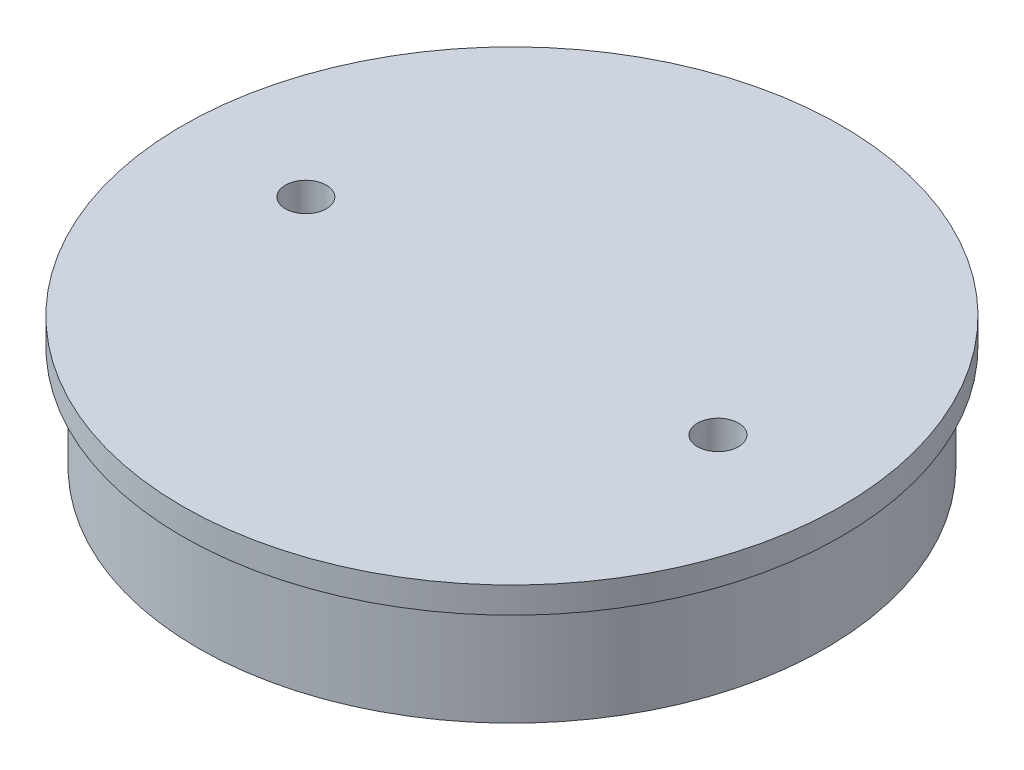
from build123d import *

# Parameters (mm, degrees)
SKETCH1_R               = 40.005
BOSS_EXTRUDE1_DEPTH     = 3.175
SKETCH1_3_R             = 38.1
BOSS_EXTRUDE2_DEPTH     = 12.7
CUT_EXTRUDE1_DEPTH      = 59.760664351
CUT_EXTRUDE1_DEPTH_BACK = 59.760664351
SKETCH3_R               = 2.4892


with BuildPart() as part:
    # Sketch1 → Boss-Extrude1 (new body)
    with BuildSketch(Plane(origin=(0, 0, 0), x_dir=(1, 0, 0), z_dir=(0, 1, 0))):
        Circle(SKETCH1_R)
    extrude(amount=BOSS_EXTRUDE1_DEPTH)

    # Sketch1<3> → Boss-Extrude2 (add)
    with BuildSketch(Plane(origin=(0, 0, 0), x_dir=(1, 0, 0), z_dir=(0, 1, 0))):
        Circle(SKETCH1_3_R)
    extrude(amount=-BOSS_EXTRUDE2_DEPTH)

    # Sketch3 → Cut-Extrude1 (cut, two sides: drawn at the far end of the back side and taken through both)
    with BuildSketch(Plane(origin=(0, 3.175, 0), x_dir=(1, 0, 0), z_dir=(0, 1, 0)).offset(-CUT_EXTRUDE1_DEPTH_BACK)):
        with Locations((-25.015, 0)):
            Circle(SKETCH3_R)
        with Locations((25.015, 0)):
            Circle(SKETCH3_R)
    extrude(amount=CUT_EXTRUDE1_DEPTH + CUT_EXTRUDE1_DEPTH_BACK, mode=Mode.SUBTRACT)


solid = part.part
